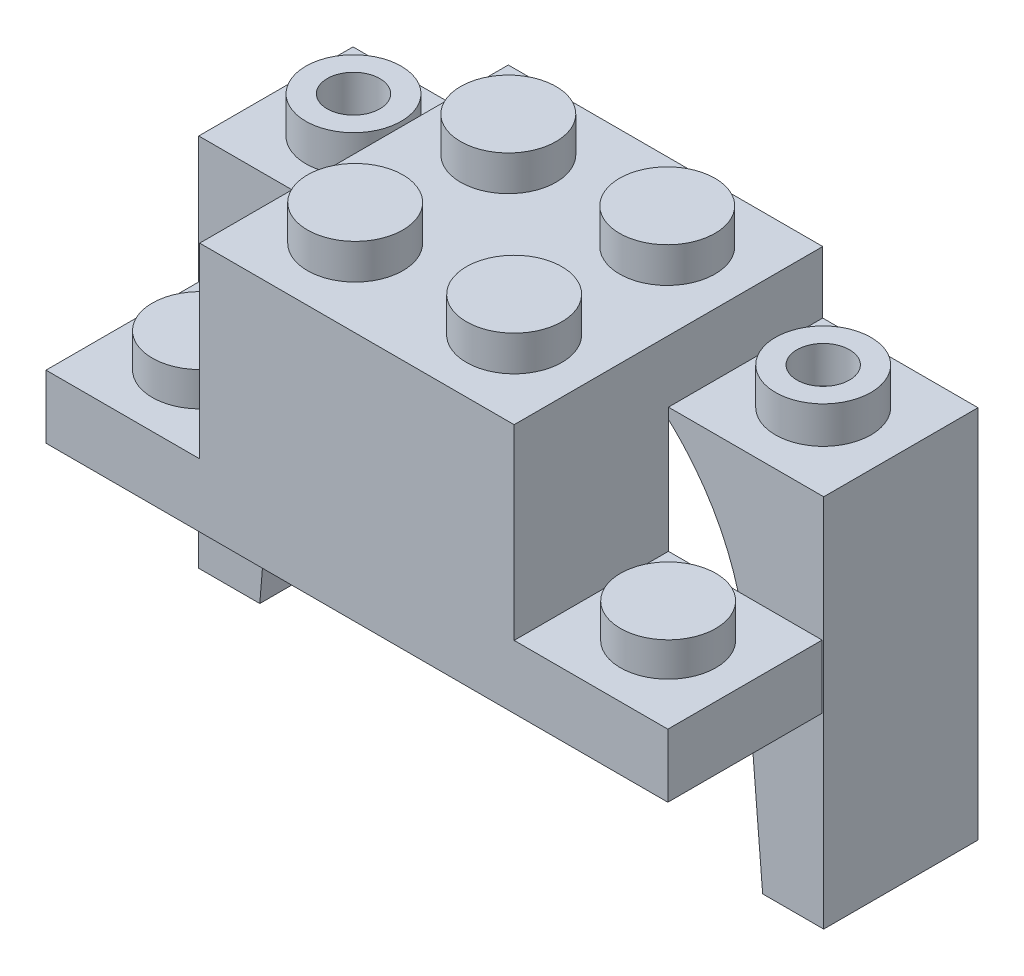
from build123d import *

# Parameters (mm, degrees)
BOSS_EXTRUDE1_DEPTH = 7.92
BOSS_EXTRUDE2_DEPTH = 7.92
SKETCH3_W           = 12.94
SKETCH3_H           = 4.9
CUT_EXTRUDE1_DEPTH  = 11.28
SKETCH4_R           = 2.45
BOSS_EXTRUDE3_DEPTH = 1.81
SKETCH5_R           = 2.45
SKETCH5_R_2         = 1.35
BOSS_EXTRUDE4_DEPTH = 1.89
CUT_EXTRUDE3_START  = -7.92
CUT_EXTRUDE3_DEPTH  = 7.92
SKETCH7_R           = 2.45
BOSS_EXTRUDE5_DEPTH = 1.75
SKETCH8_W           = 6.37
SKETCH8_H           = 6.35
CUT_EXTRUDE4_DEPTH  = 2.14
SKETCH9_R           = 0.95
CUT_EXTRUDE5_DEPTH  = 1.36
SKETCH10_R          = 0.95
CUT_EXTRUDE6_DEPTH  = 1.87


# Read off the part's stored shape, not the designer's step: Cut-Extrude3
with BuildPart() as part:
    # Sketch1 → Boss-Extrude1 (new body)
    with BuildSketch(Plane.XY):
        Polygon((-15.96, 0), (15.96, 0), (15.96, 3.25), (8.07, 3.25), (8.07, 12.84), (-8.07, 12.84), (-8.07, 3.25), (-15.96, 3.25), align=None)
    extrude(amount=-BOSS_EXTRUDE1_DEPTH)

    # Sketch2 → Boss-Extrude2 (add)
    with BuildSketch(Plane.XY.offset(-7.92)):
        Polygon((8.07, 12.84), (-8.07, 12.84), (-8.07, 9.66), (-16.04, 9.66), (-16.04, -9.56), (16.04, -9.56), (16.04, 9.66), (8.07, 9.66), align=None)
    extrude(amount=-BOSS_EXTRUDE2_DEPTH)

    # Sketch3 → Cut-Extrude1 (cut)
    with BuildSketch(Plane.XZ):
        with Locations((0, -4.02)):
            Rectangle(SKETCH3_W, SKETCH3_H)
    extrude(amount=-CUT_EXTRUDE1_DEPTH, mode=Mode.SUBTRACT)

    # Sketch4 → Boss-Extrude3 (add)
    with BuildSketch(Plane(origin=(0, 12.84, 0), x_dir=(1, 0, 0), z_dir=(0, 1, 0))):
        with Locations(Location((-4.08, 11.85, 0), (0, 0, 270))):
            Circle(SKETCH4_R)
        with Locations(Location((4.08, 11.85, 0), (0, 0, 90))):
            Circle(SKETCH4_R)
        with Locations(Location((4.08, 3.99, 0), (0, 0, 270))):
            Circle(SKETCH4_R)
        with Locations(Location((-4.08, 3.99, 0), (0, 0, 90))):
            Circle(SKETCH4_R)
    extrude(amount=BOSS_EXTRUDE3_DEPTH)

    # Sketch5 → Boss-Extrude4 (add)
    # profile 1 of 2: a face of its own
    with BuildSketch(Plane(origin=(0, 9.66, 0), x_dir=(1, 0, 0), z_dir=(0, 1, 0))):
        with Locations(Location((-12.055, 11.88, 0), (0, 0, 180))):
            Circle(SKETCH5_R)
        with Locations(Location((-12.055, 11.88, 0), (0, 0, 180))):
            Circle(SKETCH5_R_2, mode=Mode.SUBTRACT)
    # profile 2 of 2: a face of its own
    with BuildSketch(Plane(origin=(0, 9.66, 0), x_dir=(1, 0, 0), z_dir=(0, 1, 0))):
        with Locations((12.055, 11.88)):
            Circle(SKETCH5_R)
        with Locations((12.055, 11.88)):
            Circle(SKETCH5_R_2, mode=Mode.SUBTRACT)
    extrude(amount=BOSS_EXTRUDE4_DEPTH)

    # Cut-Extrude3 outline → Cut-Extrude3 (cut)
    with BuildSketch(Plane(origin=(0, 0, -15.84), x_dir=(-1, 0, 0), z_dir=(0, 0, -1)).offset(CUT_EXTRUDE3_START)):
        with BuildLine():
            add(Edge.make_bspline(
                [(-12.03116232, 1.023926949), (-11.103139384, 12.250563203), (0, 12.250563203), (11.103139384, 12.250563203), (12.03116232, 1.023926949)],
                knots=[4.796068635, 4.796068635, 4.796068635, 6.283185307, 6.283185307, 7.770301979, 7.770301979, 7.770301979], degree=2, weights=[1, 0.736064546, 1, 0.736064546, 1]))
            Line((-12.03116232, 1.023926949), (-12.906057235, -9.56))
            Line((-12.906057235, -9.56), (12.906057235, -9.56))
            Line((12.906057235, -9.56), (12.03116232, 1.023926949))
        make_face()
    extrude(amount=CUT_EXTRUDE3_DEPTH, mode=Mode.SUBTRACT)

    # Sketch7 → Boss-Extrude5 (add)
    with BuildSketch(Plane(origin=(0, 3.25, 0), x_dir=(1, 0, 0), z_dir=(0, 1, 0))):
        with Locations(Location((-12.015, 3.96, 0), (0, 0, 180))):
            Circle(SKETCH7_R)
        with Locations((12.015, 3.96)):
            Circle(SKETCH7_R)
    extrude(amount=BOSS_EXTRUDE5_DEPTH)

    # Sketch8 → Cut-Extrude4 (cut)
    with BuildSketch(Plane.XZ):
        with Locations((-11.255, -4.745)):
            Rectangle(SKETCH8_W, SKETCH8_H)
        with Locations((11.255, -4.745)):
            Rectangle(SKETCH8_W, SKETCH8_H)
    extrude(amount=-CUT_EXTRUDE4_DEPTH, mode=Mode.SUBTRACT)

    # Sketch9 → Cut-Extrude5 (cut)
    with BuildSketch(Plane(origin=(0, 2.14, 0), x_dir=(-1, 0, 0), z_dir=(0, -1, 0))):
        with Locations(Location((12.015, 3.96, 0), (0, 0, 180))):
            Circle(SKETCH9_R)
        with Locations((-12.015, 3.96)):
            Circle(SKETCH9_R)
    extrude(amount=-CUT_EXTRUDE5_DEPTH, mode=Mode.SUBTRACT)

    # Sketch10 → Cut-Extrude6 (cut)
    with BuildSketch(Plane.XZ.offset(-11.28)):
        with Locations((-4.08, -3.99)):
            Circle(SKETCH10_R)
        with Locations(Location((4.08, -3.99, 0), (0, 0, 90))):
            Circle(SKETCH10_R)
    extrude(amount=-CUT_EXTRUDE6_DEPTH, mode=Mode.SUBTRACT)


solid = part.part
